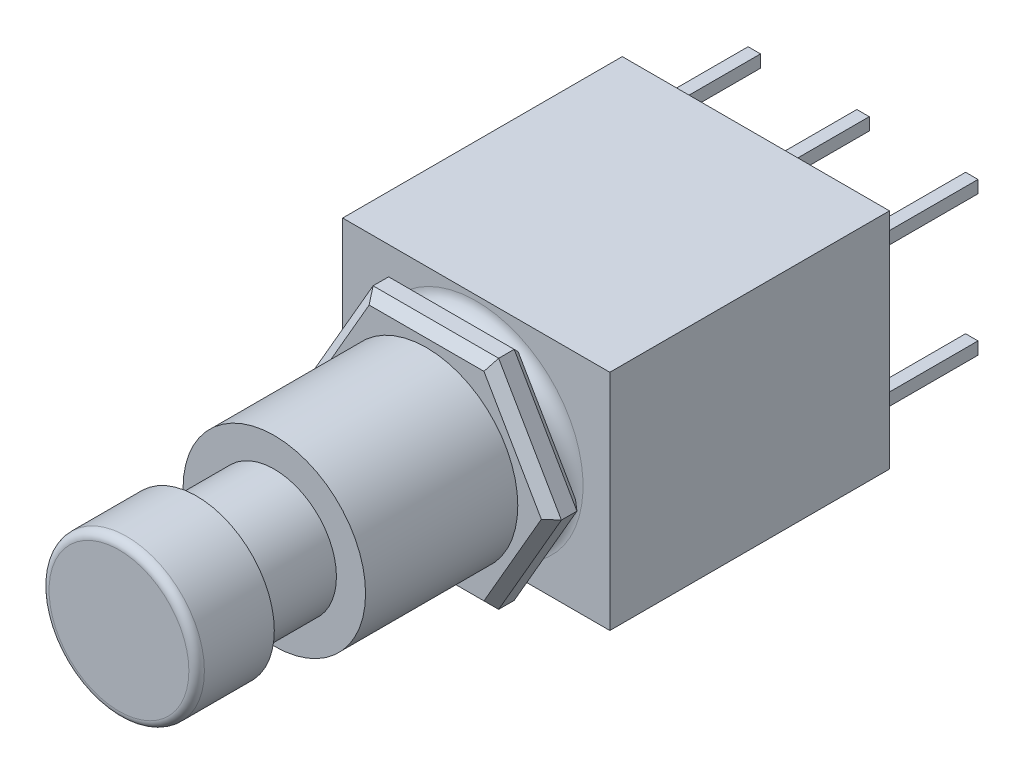
from build123d import *

# Parameters (mm, degrees)
SKETCH1_W                  = 17.2
SKETCH1_H                  = 14.4
BOSS_EXTRUDE1_DEPTH        = 18
SKETCH2_R                  = 5.875
BOSS_EXTRUDE2_DEPTH        = 13
SKETCH3_R                  = 4
BOSS_EXTRUDE3_DEPTH        = 5
SKETCH4_R                  = 5
BOSS_EXTRUDE4_DEPTH        = 5
SKETCH5_W                  = 10
SKETCH5_H                  = 7.5
BOSS_EXTRUDE5_DEPTH        = 1.2
SKETCH6_W                  = 0.8
SKETCH6_H                  = 0.8
BOSS_EXTRUDE6_DEPTH        = 7.3
CHAMFER1_SIZE              = 0.4
FILLET1_R                  = 1
FILLET2_R                  = 0.5
SKETCH7_R                  = 5.875
BOSS_EXTRUDE7_DEPTH        = 2.2
CHAMFER2_SIZE              = 0.6
LPATTERN1_COUNT            = 3
LPATTERN1_PITCH            = 7
LPATTERN1_COUNT_DIR2       = 2
LPATTERN1_PITCH_DIR2       = 9
CHAMFER1_OF_LPATTERN1_SIZE = 0.4


with BuildPart() as part:
    # Sketch1 → Boss-Extrude1 (new body)
    with BuildSketch(Plane.XY):
        with Locations((8.6, 7.2)):
            Rectangle(SKETCH1_W, SKETCH1_H)
    extrude(amount=BOSS_EXTRUDE1_DEPTH)

    # Sketch2 → Boss-Extrude2 (add)
    with BuildSketch(Plane.XY.offset(18)):
        with Locations(Location((8.6, 7.2, 0), (0, 0, 180))):
            Circle(SKETCH2_R)
    extrude(amount=BOSS_EXTRUDE2_DEPTH)

    # Sketch3 → Boss-Extrude3 (add)
    with BuildSketch(Plane.XY.offset(31)):
        with Locations((8.6, 7.2)):
            Circle(SKETCH3_R)
    extrude(amount=BOSS_EXTRUDE3_DEPTH)

    # Sketch4 → Boss-Extrude4 (add)
    with BuildSketch(Plane.XY.offset(36)):
        with Locations((8.6, 7.2)):
            Circle(SKETCH4_R)
    extrude(amount=BOSS_EXTRUDE4_DEPTH)

    # Sketch5 → Boss-Extrude5 (add)
    with BuildSketch(Plane(origin=(0, 0, 0), x_dir=(-1, 0, 0), z_dir=(0, 0, -1))):
        with Locations((-8.6, 7.2)):
            Rectangle(SKETCH5_W, SKETCH5_H)
    extrude(amount=BOSS_EXTRUDE5_DEPTH)

    # Sketch6 → Boss-Extrude6 (add)
    with BuildSketch(Plane(origin=(0, 0, 0), x_dir=(-1, 0, 0), z_dir=(0, 0, -1))):
        with Locations((-15.6, 11.7)):
            Rectangle(SKETCH6_W, SKETCH6_H)
    boss_extrude6 = extrude(amount=BOSS_EXTRUDE6_DEPTH)

    # Chamfer1
    chamfer1_edges = [part.edges().sort_by_distance(p)[0] for p in [
        (15.2, 11.7, -7.3),
        (15.6, 12.1, -7.3),
        (16, 11.7, -7.3),
        (15.6, 11.3, -7.3),
    ]]
    chamfer(chamfer1_edges, length=CHAMFER1_SIZE - 0.0001)  # a hair under: the kernel refuses the full size

    # Fillet1
    fillet1_edges = [part.edges().sort_by_distance(p)[0] for p in [
        (14.475, 7.2, 18),
    ]]
    fillet(fillet1_edges, radius=FILLET1_R)

    # Fillet2
    fillet2_edges = [part.edges().sort_by_distance(p)[0] for p in [
        (3.6, 7.2, 41),
    ]]
    fillet(fillet2_edges, radius=FILLET2_R)

    # Sketch7 → Boss-Extrude7 (add)
    with BuildSketch(Plane.XY.offset(19)):
        Polygon((16.682903769, 7.2), (12.641451884, 14.2), (4.558548116, 14.2), (0.517096231, 7.2), (4.558548116, 0.2), (12.641451884, 0.2), align=None)
        with Locations(Location((8.6, 7.2, 0), (0, 0, 180))):
            Circle(SKETCH7_R, mode=Mode.SUBTRACT)
    extrude(amount=BOSS_EXTRUDE7_DEPTH)

    # Chamfer2
    chamfer2_edges = [part.edges().sort_by_distance(p)[0] for p in [
        (14.662177826, 3.7, 21.2),
        (14.662177826, 10.7, 21.2),
        (8.6, 14.2, 21.2),
        (2.537822174, 10.7, 21.2),
        (2.537822174, 3.7, 21.2),
        (8.6, 0.2, 21.2),
        (14.662177826, 3.7, 19),
        (14.662177826, 10.7, 19),
        (8.6, 14.2, 19),
        (2.537822174, 10.7, 19),
        (2.537822174, 3.7, 19),
        (8.6, 0.2, 19),
    ]]
    chamfer(chamfer2_edges, length=CHAMFER2_SIZE)

    # LPattern1: Boss-Extrude6 3 × 2
    with Locations(*[(-i * LPATTERN1_PITCH, -j * LPATTERN1_PITCH_DIR2, 0) for i in range(LPATTERN1_COUNT) for j in range(LPATTERN1_COUNT_DIR2) if (i, j) != (0, 0)]):
        add(boss_extrude6)

    # Chamfer1 of LPattern1
    chamfer1_of_lpattern1_edges = [part.edges().sort_by_distance(p)[0] for p in [
        (15.2, 2.7, -7.3),
        (15.6, 3.1, -7.3),
        (16, 2.7, -7.3),
        (15.6, 2.3, -7.3),
        (8.2, 11.7, -7.3),
        (8.6, 12.1, -7.3),
        (9, 11.7, -7.3),
        (8.6, 11.3, -7.3),
        (8.2, 2.7, -7.3),
        (8.6, 3.1, -7.3),
        (9, 2.7, -7.3),
        (8.6, 2.3, -7.3),
        (1.2, 11.7, -7.3),
        (1.6, 12.1, -7.3),
        (2, 11.7, -7.3),
        (1.6, 11.3, -7.3),
        (1.2, 2.7, -7.3),
        (1.6, 3.1, -7.3),
        (2, 2.7, -7.3),
        (1.6, 2.3, -7.3),
    ]]
    chamfer(chamfer1_of_lpattern1_edges, length=CHAMFER1_OF_LPATTERN1_SIZE - 0.0001)  # a hair under: the kernel refuses the full size


solid = part.part
